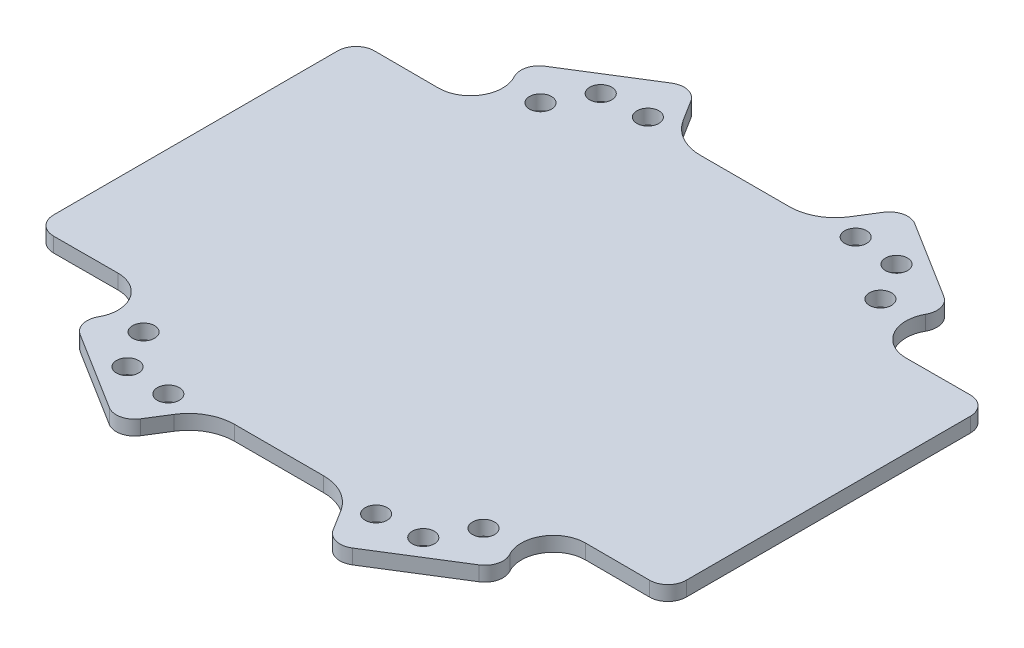
from build123d import *

# Parameters (mm, degrees)
BOSS_EXTRUDE1_DEPTH     = 0.8
FILLET1_R               = 3.5
FILLET2_R               = 5
FILLET3_R               = 2
SKETCH3_R               = 1.2
CUT_EXTRUDE1_DEPTH      = 47.37844339
MIRROR2_COPY_1_SKETCH_R = 1.2
MIRROR2_COPY_1_DEPTH    = 47.37844339


with BuildPart() as part:
    # Sketch2 → Boss-Extrude1 (new, symmetric)
    with BuildSketch(Plane(origin=(0, 0, 0), x_dir=(1, 0, 0), z_dir=(0, 1, 0))):
        Polygon((-34.5, -17.5), (-34.5, 17.5), (-19.164918189, 17.456295518), (-23.435988128, 24.29000742), (-11.564011872, 31.70999258), (-7.623299146, 25.404852218), (7.623299146, 25.404852218), (11.564011872, 31.70999258), (23.435988128, 24.29000742), (19.164918189, 17.456295518), (34.5, 17.5), (34.5, -17.5), (19.164918189, -17.456295518), (23.435988128, -24.29000742), (11.564011872, -31.70999258), (7.623299146, -25.404852218), (-7.623299146, -25.404852218), (-11.564011872, -31.70999258), (-23.435988128, -24.29000742), (-19.164918189, -17.456295518), align=None)
    extrude(amount=BOSS_EXTRUDE1_DEPTH, both=True)

    # Fillet1
    fillet1_edges = [part.edges().sort_by_distance(p)[0] for p in [
        (19.164918189, 0, 17.456295518),
        (-19.164918189, 0, 17.456295518),
        (19.164918189, 0, -17.456295518),
        (-19.164918189, 0, -17.456295518),
    ]]
    fillet(fillet1_edges, radius=FILLET1_R)

    # Fillet2
    fillet2_edges = [part.edges().sort_by_distance(p)[0] for p in [
        (7.623299146, 0, 25.404852218),
        (-7.623299146, 0, 25.404852218),
        (7.623299146, 0, -25.404852218),
        (-7.623299146, 0, -25.404852218),
    ]]
    fillet(fillet2_edges, radius=FILLET2_R)

    # Fillet3
    fillet3_edges = [part.edges().sort_by_distance(p)[0] for p in [
        (34.5, 0, -17.5),
        (23.435988128, 0, -24.29000742),
        (34.5, 0, 17.5),
        (23.435988128, 0, 24.29000742),
        (11.564011872, 0, 31.70999258),
        (11.564011872, 0, -31.70999258),
        (-11.564011872, 0, -31.70999258),
        (-23.435988128, 0, -24.29000742),
        (-34.5, 0, -17.5),
        (-34.5, 0, 17.5),
        (-11.564011872, 0, 31.70999258),
        (-23.435988128, 0, 24.29000742),
    ]]
    fillet(fillet3_edges, radius=FILLET3_R)

    # Sketch3 → Cut-Extrude1 (cut, through all)
    with BuildSketch(Plane(origin=(0, 0.8, 0), x_dir=(1, 0, 0), z_dir=(0, 1, 0))):
        with Locations((-16.127132138, 25.803411421)):
            Circle(SKETCH3_R)
        with Locations((-11.330641731, 26.147910732)):
            Circle(SKETCH3_R)
        with Locations((-18.538627315, 21.642919742)):
            Circle(SKETCH3_R)
    cut_extrude1 = extrude(amount=-CUT_EXTRUDE1_DEPTH, mode=Mode.SUBTRACT)

    # Mirror1: Cut-Extrude1 across plane
    add(cut_extrude1.mirror(Plane(origin=(0, 0, 0), x_dir=(0, 0, 1), z_dir=(1, 0, 0))), mode=Mode.SUBTRACT)

    # Mirror2: Cut-Extrude1 across plane
    add(cut_extrude1.mirror(Plane.XY), mode=Mode.SUBTRACT)

    # Mirror2 copy 1 sketch → Mirror2 copy 1 (cut, through all)
    with BuildSketch(Plane(origin=(0, 0.8, 0), x_dir=(-1, 0, 0), z_dir=(0, 1, 0))):
        with Locations((-16.127132138, 25.803411421)):
            Circle(MIRROR2_COPY_1_SKETCH_R)
        with Locations((-11.330641731, 26.147910732)):
            Circle(MIRROR2_COPY_1_SKETCH_R)
        with Locations((-18.538627315, 21.642919742)):
            Circle(MIRROR2_COPY_1_SKETCH_R)
    extrude(amount=-MIRROR2_COPY_1_DEPTH, mode=Mode.SUBTRACT)


solid = part.part
